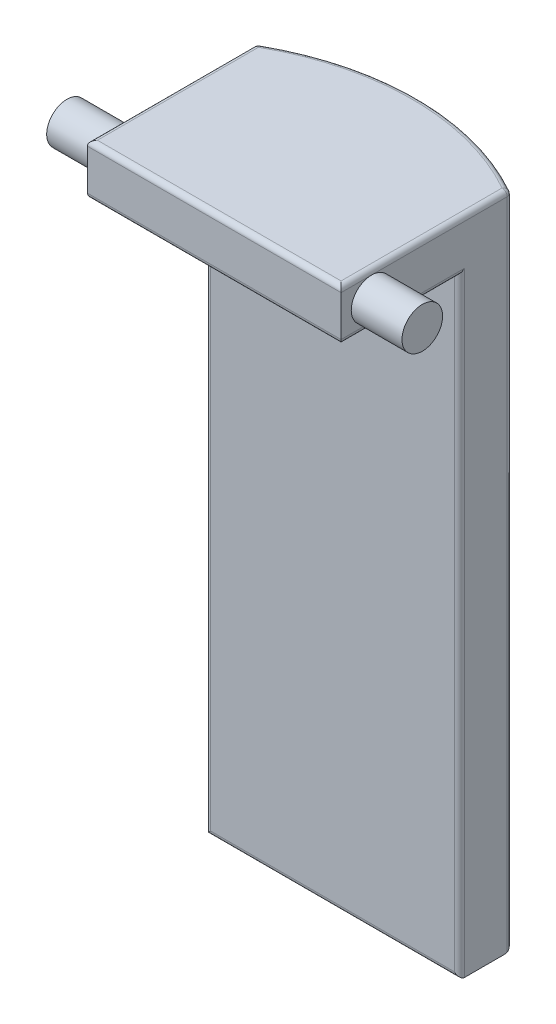
from build123d import *

# Parameters (mm, degrees)
SKETCH1_R                = 25
BOSS_EXTRUDE1_DEPTH      = 69
CUT_EXTRUDE3_DEPTH       = 69
SKETCH8_W                = 47.613521064
SKETCH8_H                = 96.094714493
CUT_EXTRUDE6_DEPTH       = 69
SKETCH9_W                = 16.650635095
SKETCH9_H                = 64
CUT_EXTRUDE7_DEPTH       = 69
SKETCH10_W               = 5
SKETCH10_H               = 9.23187044
CUT_EXTRUDE8_DEPTH       = 69
BOSS_EXTRUDE2_DEPTH      = 5
BOSS_EXTRUDE2_DEPTH_BACK = 30
SKETCH11_R               = 2
SKETCH12_W               = 21.924143589
SKETCH12_H               = 4
CUT_EXTRUDE9_DEPTH       = 80.284298572
FILLET1_R                = 0.5


with BuildPart() as part:
    # Sketch1 → Boss-Extrude1 (new body)
    with BuildSketch(Plane(origin=(0, 0, 0), x_dir=(1, 0, 0), z_dir=(0, 1, 0))):
        with Locations(Location((0, 0, 0), (0, 0, 270))):
            Circle(SKETCH1_R)
    extrude(amount=-BOSS_EXTRUDE1_DEPTH)

    # Sketch2 → Cut-Extrude3 (cut)
    with BuildSketch(Plane(origin=(0, 0, 0), x_dir=(1, 0, 0), z_dir=(0, 1, 0))):
        with BuildLine():
            Line((-12.5, -21.650635095), (-12.5, 21.650635095))
            ThreePointArc((-12.5, 21.650635095), (-25, 0), (-12.5, -21.650635095))
        make_face()
        with BuildLine():
            ThreePointArc((25, 0), (21.650635095, 12.5), (12.5, 21.650635095))
            Line((12.5, 21.650635095), (12.5, -21.650635095))
            ThreePointArc((12.5, -21.650635095), (21.650635095, -12.5), (25, 0))
        make_face()
    extrude(amount=-CUT_EXTRUDE3_DEPTH, mode=Mode.SUBTRACT)

    # Sketch8 → Cut-Extrude6 (cut)
    with BuildSketch(Plane(origin=(12.5, 0, 0), x_dir=(0, 0, -1), z_dir=(1, 0, 0))):
        with Locations((-23.806760532, -34.608459046)):
            Rectangle(SKETCH8_W, SKETCH8_H)
    extrude(amount=-CUT_EXTRUDE6_DEPTH, mode=Mode.SUBTRACT)

    # Sketch9 → Cut-Extrude7 (cut)
    with BuildSketch(Plane(origin=(12.5, 0, 0), x_dir=(0, 0, -1), z_dir=(1, 0, 0))):
        with Locations((8.325317548, -37)):
            Rectangle(SKETCH9_W, SKETCH9_H)
    extrude(amount=-CUT_EXTRUDE7_DEPTH, mode=Mode.SUBTRACT)

    # Sketch10 → Cut-Extrude8 (cut)
    with BuildSketch(Plane(origin=(12.5, 0, 0), x_dir=(0, 0, -1), z_dir=(1, 0, 0))):
        with Locations((2.5, -4.61593522)):
            Rectangle(SKETCH10_W, SKETCH10_H)
    extrude(amount=-CUT_EXTRUDE8_DEPTH, mode=Mode.SUBTRACT)

    # Sketch11 → Boss-Extrude2 (add, two sides: drawn at the far end of the back side and taken through both)
    with BuildSketch(Plane(origin=(12.5, 0, 0), x_dir=(0, 0, -1), z_dir=(1, 0, 0)).offset(-BOSS_EXTRUDE2_DEPTH_BACK)):
        with Locations((8, -2.5)):
            Circle(SKETCH11_R)
    extrude(amount=BOSS_EXTRUDE2_DEPTH + BOSS_EXTRUDE2_DEPTH_BACK)

    # Sketch12 → Cut-Extrude9 (cut, through all)
    with BuildSketch(Plane(origin=(12.5, 0, 0), x_dir=(0, 0, -1), z_dir=(1, 0, 0))):
        with Locations((27.61270689, -67)):
            Rectangle(SKETCH12_W, SKETCH12_H)
    extrude(amount=-CUT_EXTRUDE9_DEPTH, mode=Mode.SUBTRACT)

    # Fillet1
    fillet1_edges = [part.edges().sort_by_distance(p)[0] for p in [
        (12.5, -35, -16.650635095),
        (0, -65, -16.650635095),
        (-12.5, -32.5, -21.650635095),
        (12.5, -32.5, -21.650635095),
        (0, -65, -25),
        (-12.5, 0, -13.325317547),
        (12.5, 0, -13.325317547),
        (-12.5, -35, -16.650635095),
        (12.5, -5, -10.825317547),
        (0, 0, -25),
        (-12.5, -5, -10.825317547),
        (0, -5, -5),
        (0, 0, -5),
    ]]
    fillet(fillet1_edges, radius=FILLET1_R - 0.0001)  # a hair under: the kernel refuses the full size


solid = part.part
